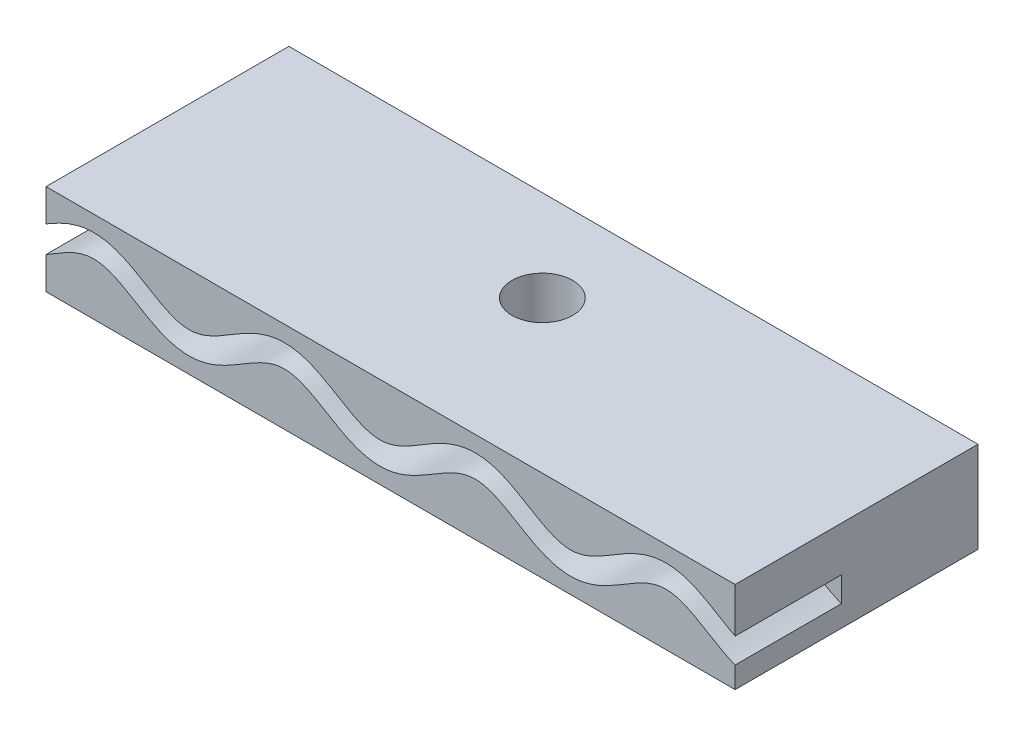
from build123d import *

# Parameters (mm, degrees)
SKETCH1_W               = 45.4
SKETCH1_H               = 16
BOSS_EXTRUDE1_DEPTH     = 6
CUT_EXTRUDE_THIN1_START = -7
CUT_EXTRUDE_THIN1_DEPTH = 7
SKETCH3_R               = 2
CUT_EXTRUDE4_DEPTH      = 10


# Read off the part's stored shape, not the designer's step: Cut-Extrude-Thin1
with BuildPart() as part:
    # Sketch1 → Boss-Extrude1 (new body)
    with BuildSketch(Plane(origin=(0, 0, 0), x_dir=(1, 0, 0), z_dir=(0, 1, 0))):
        with Locations((22.7, 8)):
            Rectangle(SKETCH1_W, SKETCH1_H)
    extrude(amount=BOSS_EXTRUDE1_DEPTH)

    # Cut-Extrude-Thin1 outline → Cut-Extrude-Thin1 (cut)
    with BuildSketch(Plane.XY.offset(CUT_EXTRUDE_THIN1_START)):
        with BuildLine():
            Line((0, 3.873267445), (0, 2.126817741))
            add(Edge.make_bspline(
                [(0, 2.126817741), (0.02703382, 2.142781723), (0.054175194, 2.15885723), (0.199802786, 2.245191001), (0.318904635, 2.316609427), (0.547456156, 2.453801634), (0.659404505, 2.520881504), (1.223235747, 2.852563391), (1.659129881, 3.090081368), (2.304021331, 3.325798968), (2.516053427, 3.383726921), (2.935514936, 3.449959162), (3.142910642, 3.458369463), (3.767815623, 3.407863189), (4.19408996, 3.269324885), (5.065062464, 2.858321616), (5.50706417, 2.591187682), (6.431683782, 2.036459554), (6.918071796, 1.744087969), (7.740579172, 1.381104099), (8.030251466, 1.273290225), (8.645579036, 1.112784531), (8.970876862, 1.062103691), (9.62744136, 1.04193798), (9.958039149, 1.072725046), (10.589024972, 1.202402245), (10.888026805, 1.299103066), (11.452805261, 1.525556109), (11.718970495, 1.655461765), (12.226161625, 1.926507336), (12.467522401, 2.067716558), (13.170775959, 2.486480844), (13.615931783, 2.76197178), (14.271958768, 3.092921072), (14.487846746, 3.188741776), (14.917075207, 3.339470443), (15.130272064, 3.394343156), (15.548156295, 3.45349324), (15.75427037, 3.457987949), (16.172816849, 3.416681909), (16.383607329, 3.371026255), (17.022785721, 3.167898464), (17.460128234, 2.943866168), (18.351607435, 2.430583519), (18.80881458, 2.139021166), (19.556952632, 1.727762653), (19.816902465, 1.594900544), (20.369439987, 1.356573587), (20.663597747, 1.251179423), (21.283479066, 1.10005025), (21.609016745, 1.054814487), (22.266771634, 1.045847552), (22.596742032, 1.083145554), (23.222365778, 1.221962497), (23.519472543, 1.321980696), (24.079382347, 1.553570863), (24.342766312, 1.684865845), (25.098173394, 2.093571519), (25.557376229, 2.385193139), (26.452683258, 2.906328822), (26.887914853, 3.135436001), (27.746180841, 3.425860973), (28.158539125, 3.480470405), (28.786299796, 3.408170386), (28.995968884, 3.359210465), (29.423947166, 3.216861002), (29.641162564, 3.124110993), (30.296525986, 2.802852497), (30.738363236, 2.530814809), (31.671813969, 1.97293848), (32.163881244, 1.683121755), (33.000138587, 1.332534814), (33.296467876, 1.230806571), (33.92016789, 1.088242868), (34.248675292, 1.048205652), (34.907059265, 1.051622384), (35.233888776, 1.094812192), (35.854823483, 1.241938496), (36.150275582, 1.345434697), (36.705793014, 1.582138569), (36.966535771, 1.714713739), (37.46618007, 1.988138513), (37.705434355, 2.129457341), (38.404356673, 2.547696158), (38.845749072, 2.818233186), (39.500657349, 3.136109655), (39.717214125, 3.227177696), (40.144711185, 3.365892553), (40.354662828, 3.412992927), (40.773030437, 3.457293529), (40.980435207, 3.454517198), (41.398028958, 3.398951825), (41.610067714, 3.345773528), (42.253288523, 3.123436571), (42.689155986, 2.891534001), (43.585746337, 2.368048308), (44.045555086, 2.076103322), (44.804100753, 1.668638949), (45.068118248, 1.538339158), (45.366705882, 1.416907758), (45.383339369, 1.410218973), (45.4, 1.403598957)],
                knots=[0.01380316, 0.01380316, 0.01380316, 0.01380316, 0.015625, 0.015625, 0.0234375, 0.0234375, 0.03125, 0.03125, 0.0625, 0.0625, 0.078125, 0.078125, 0.09375, 0.09375, 0.125, 0.125, 0.15625, 0.15625, 0.1875, 0.1875, 0.203125, 0.203125, 0.21875, 0.21875, 0.234375, 0.234375, 0.25, 0.25, 0.265625, 0.265625, 0.28125, 0.28125, 0.3125, 0.3125, 0.328125, 0.328125, 0.34375, 0.34375, 0.359375, 0.359375, 0.375, 0.375, 0.40625, 0.40625, 0.4375, 0.4375, 0.453125, 0.453125, 0.46875, 0.46875, 0.484375, 0.484375, 0.5, 0.5, 0.515625, 0.515625, 0.53125, 0.53125, 0.5625, 0.5625, 0.59375, 0.59375, 0.625, 0.625, 0.640625, 0.640625, 0.65625, 0.65625, 0.6875, 0.6875, 0.71875, 0.71875, 0.734375, 0.734375, 0.75, 0.75, 0.765625, 0.765625, 0.78125, 0.78125, 0.796875, 0.796875, 0.8125, 0.8125, 0.84375, 0.84375, 0.859375, 0.859375, 0.875, 0.875, 0.890625, 0.890625, 0.90625, 0.90625, 0.9375, 0.9375, 0.96875, 0.96875, 0.984375, 0.984375, 0.985295787, 0.985295787, 0.985295787, 0.985295787], degree=3))
            Line((45.4, 1.403598957), (45.400000004, 3.052714))
            add(Edge.make_bspline(
                [(0, 3.873267445), (0.003867713, 3.875545356), (0.007738546, 3.877823787), (0.250469006, 4.020613492), (0.495079597, 4.160053663), (1.012890651, 4.425250629), (1.284740564, 4.550297134), (1.86347111, 4.76183192), (2.171314028, 4.847876947), (2.81235644, 4.949096426), (3.145282675, 4.963068961), (3.798820837, 4.910248487), (4.117293225, 4.844555634), (4.718708859, 4.662401706), (5.002040385, 4.546684188), (5.805070872, 4.167742082), (6.282596051, 3.875154302), (7.19954989, 3.325025275), (7.637556428, 3.066144173), (8.289263977, 2.778536627), (8.504994239, 2.69964625), (8.928037725, 2.589297078), (9.136444307, 2.5577258), (9.553972433, 2.544901849), (9.761498066, 2.56368264), (10.181642273, 2.650028675), (10.396038802, 2.717920292), (11.044459748, 2.97791055), (11.480747342, 3.225921565), (12.388245941, 3.766307033), (12.856524649, 4.058933488), (13.638246286, 4.453292605), (13.913435199, 4.576828438), (14.497506198, 4.7819319), (14.80657005, 4.863476297), (15.451409614, 4.954751133), (15.785477854, 4.962195082), (16.436245788, 4.89797128), (16.752702226, 4.827653432), (17.349238381, 4.638077136), (17.629199854, 4.520162486), (18.160549165, 4.264517545), (18.412038425, 4.126652649), (19.138888817, 3.708157529), (19.588011382, 3.422386166), (20.472304829, 2.936281753), (20.905689258, 2.736093288), (21.540410043, 2.581346203), (21.750486993, 2.553025254), (22.166195505, 2.54735805), (22.37309431, 2.570002638), (23.007695036, 2.710811445), (23.43961466, 2.901695121), (24.321951208, 3.379074751), (24.769938492, 3.662450532), (25.49069199, 4.081982999), (25.739774147, 4.221113848), (26.265324427, 4.481051988), (26.542139405, 4.601982239), (27.130361027, 4.801028048), (27.443653593, 4.878863839), (28.09178915, 4.958640067), (28.424563097, 4.959747626), (29.072774338, 4.885092288), (29.387887281, 4.80965047), (29.978856326, 4.6130888), (30.256280206, 4.493108966), (31.047007705, 4.105495135), (31.519931981, 3.811184839), (32.42927946, 3.267713808), (32.86899683, 3.013998451), (33.733669543, 2.651498841), (34.155257129, 2.54774105), (34.984908919, 2.552046589), (35.407860618, 2.659586891), (36.056133151, 2.93581336), (36.27510638, 3.046251422), (36.71743538, 3.288311037), (36.940487753, 3.419765313), (37.623548397, 3.828512419), (38.098120254, 4.122708489), (38.891992645, 4.508034742), (39.171037756, 4.62694392), (39.764967834, 4.8196632), (40.081148481, 4.892416665), (40.730643342, 4.961191141), (41.063783913, 4.956647377), (41.710375198, 4.870611401), (42.021587579, 4.790610545), (42.607447829, 4.58810095), (42.883262745, 4.465659864), (43.406242203, 4.204194984), (43.654228228, 4.065020041), (44.372851449, 3.645442724), (44.820928505, 3.362312101), (45.307481866, 3.100952543), (45.353788309, 3.07654159), (45.400000004, 3.052714)],
                knots=[0.030996579, 0.030996579, 0.030996579, 0.030996579, 0.03125, 0.03125, 0.046875, 0.046875, 0.0625, 0.0625, 0.078125, 0.078125, 0.09375, 0.09375, 0.109375, 0.109375, 0.125, 0.125, 0.15625, 0.15625, 0.1875, 0.1875, 0.203125, 0.203125, 0.21875, 0.21875, 0.234375, 0.234375, 0.25, 0.25, 0.28125, 0.28125, 0.3125, 0.3125, 0.328125, 0.328125, 0.34375, 0.34375, 0.359375, 0.359375, 0.375, 0.375, 0.390625, 0.390625, 0.40625, 0.40625, 0.4375, 0.4375, 0.46875, 0.46875, 0.484375, 0.484375, 0.5, 0.5, 0.53125, 0.53125, 0.5625, 0.5625, 0.578125, 0.578125, 0.59375, 0.59375, 0.609375, 0.609375, 0.625, 0.625, 0.640625, 0.640625, 0.65625, 0.65625, 0.6875, 0.6875, 0.71875, 0.71875, 0.75, 0.75, 0.78125, 0.78125, 0.796875, 0.796875, 0.8125, 0.8125, 0.84375, 0.84375, 0.859375, 0.859375, 0.875, 0.875, 0.890625, 0.890625, 0.90625, 0.90625, 0.921875, 0.921875, 0.9375, 0.9375, 0.96875, 0.96875, 0.972044951, 0.972044951, 0.972044951, 0.972044951], degree=3))
        make_face()
    extrude(amount=CUT_EXTRUDE_THIN1_DEPTH, mode=Mode.SUBTRACT)

    # Sketch3 → Cut-Extrude4 (cut)
    with BuildSketch(Plane(origin=(0, 6, 0), x_dir=(1, 0, 0), z_dir=(0, 1, 0))):
        with Locations(Location((22.7, 10, 0), (0, 0, 270))):
            Circle(SKETCH3_R)
    extrude(amount=-CUT_EXTRUDE4_DEPTH, mode=Mode.SUBTRACT)


solid = part.part
